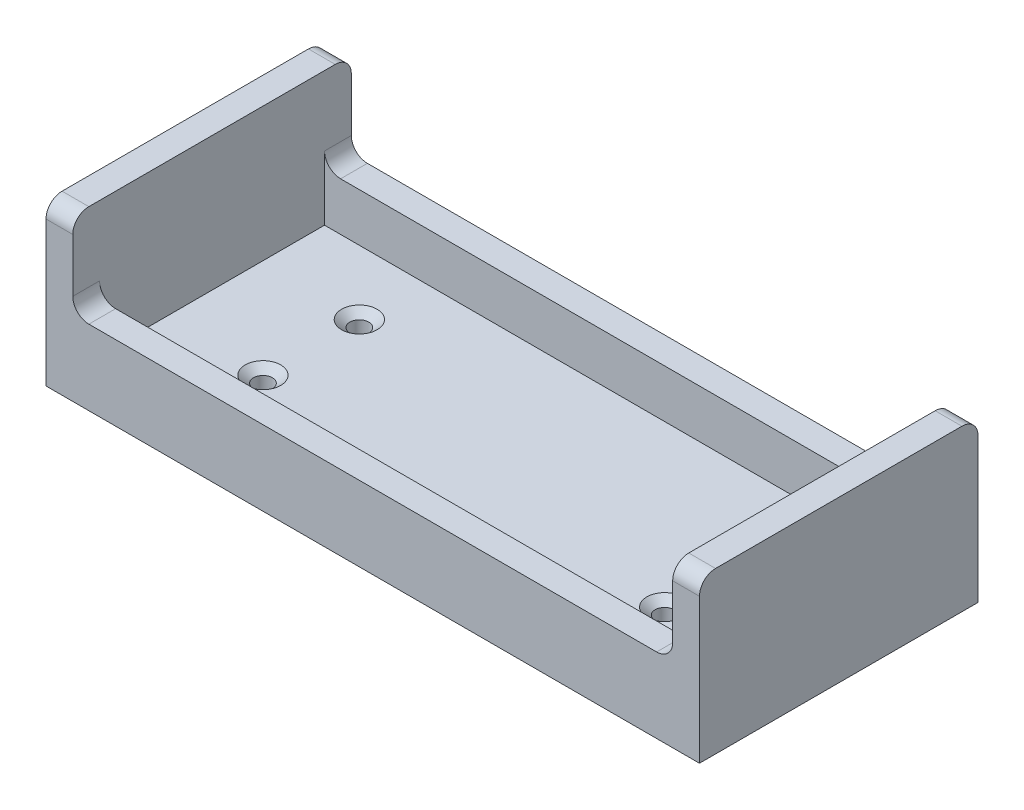
from build123d import *

# Parameters (mm, degrees)
SKETCH1_W                                         = 6.35
SKETCH1_H                                         = 66.04
BOSS_EXTRUDE1_DEPTH                               = 38.1
BOSS_EXTRUDE1_2_DEPTH                             = 38.1
SKETCH1_4_W                                       = 142.24
SKETCH1_4_H                                       = 53.34
BOSS_EXTRUDE2_DEPTH                               = 6.35
SKETCH1_5_W                                       = 142.24
SKETCH1_5_H                                       = 6.35
BOSS_EXTRUDE3_DEPTH                               = 17.78
FILLET1_R                                         = 3.81
CSK_FOR_8_FLAT_HEAD_MACHINE_SCREW_100_D           = 4.4958
CSK_FOR_8_FLAT_HEAD_MACHINE_SCREW_100_CSINK_D     = 8.4328
CSK_FOR_8_FLAT_HEAD_MACHINE_SCREW_100_CSINK_ANGLE = 100


with BuildPart() as part:
    # Sketch1 → Boss-Extrude1 (new body)
    with BuildSketch(Plane(origin=(0, 0, 0), x_dir=(1, 0, 0), z_dir=(0, 1, 0))):
        with Locations((-72.630450684, -4.602178218)):
            Rectangle(SKETCH1_W, SKETCH1_H)
    extrude(amount=BOSS_EXTRUDE1_DEPTH)



with BuildPart() as body_2:
    # Sketch1 → Boss-Extrude1 2 (new body)
    with BuildSketch(Plane(origin=(0, 0, 0), x_dir=(1, 0, 0), z_dir=(0, 1, 0))):
        with Locations((75.959549316, -4.602178218)):
            Rectangle(SKETCH1_W, SKETCH1_H)
    extrude(amount=BOSS_EXTRUDE1_2_DEPTH)


with BuildPart() as part_1:
    add(part.part)

    add(body_2.part)  # Boss-Extrude2 merges body 2
    # Sketch1<4> → Boss-Extrude2 (add)
    with BuildSketch(Plane(origin=(0, 0, 0), x_dir=(1, 0, 0), z_dir=(0, 1, 0))):
        with Locations((1.664549316, -4.602178218)):
            Rectangle(SKETCH1_4_W, SKETCH1_4_H)
    extrude(amount=BOSS_EXTRUDE2_DEPTH)

    # Sketch1<5> → Boss-Extrude3 (add)
    with BuildSketch(Plane(origin=(0, 0, 0), x_dir=(1, 0, 0), z_dir=(0, 1, 0))):
        with Locations((1.664549316, 25.242821782)):
            Rectangle(SKETCH1_5_W, SKETCH1_5_H)
        with Locations((1.664549316, -34.447178218)):
            Rectangle(SKETCH1_5_W, SKETCH1_5_H)
    extrude(amount=BOSS_EXTRUDE3_DEPTH)

    # Fillet1
    fillet1_edges = [part_1.edges().sort_by_distance(p)[0] for p in [
        (72.784549316, 17.78, 34.447178218),
        (72.784549316, 17.78, -25.242821782),
        (75.959549316, 38.1, -28.417821782),
        (75.959549316, 38.1, 37.622178218),
        (-72.630450684, 38.1, -28.417821782),
        (-69.455450684, 17.78, -25.242821782),
        (-69.455450684, 17.78, 34.447178218),
        (-72.630450684, 38.1, 37.622178218),
    ]]
    fillet(fillet1_edges, radius=FILLET1_R)

    # CSK for #8 Flat Head Machine Screw (100)2 (through all)
    with Locations(Plane(origin=(0, 6.35, 0), x_dir=(1, 0, 0), z_dir=(0, 1, 0))):
        with Locations((-45.960450684, -16.032178218), (-45.960450684, 6.827821782), (49.289549316, 6.827821782), (49.289549316, -16.032178218)):
            CounterSinkHole(CSK_FOR_8_FLAT_HEAD_MACHINE_SCREW_100_D / 2, CSK_FOR_8_FLAT_HEAD_MACHINE_SCREW_100_CSINK_D / 2, counter_sink_angle=CSK_FOR_8_FLAT_HEAD_MACHINE_SCREW_100_CSINK_ANGLE)


solid = part_1.part
